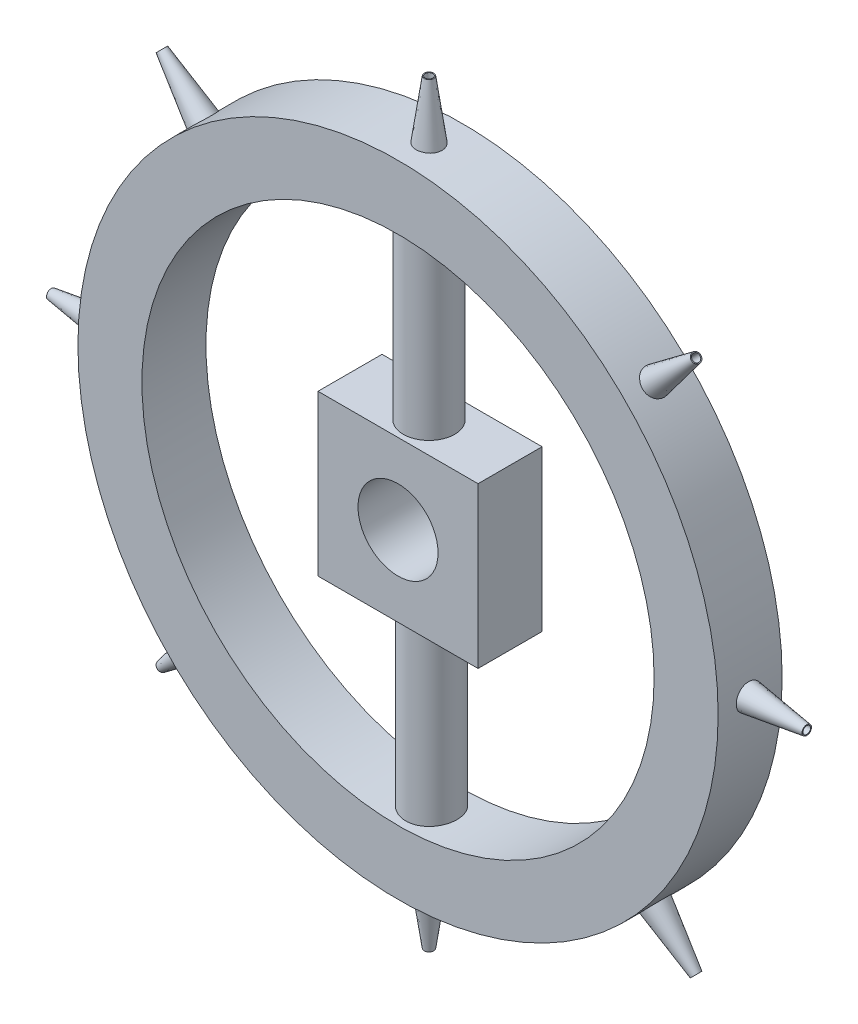
from build123d import *

# Parameters (mm, degrees)
SKETCH1_R                = 100
SKETCH1_R_2              = 80
BOSS_EXTRUDE1_DEPTH      = 20
SKETCH3_W                = 50
SKETCH3_H                = 50
BOSS_EXTRUDE2_DEPTH      = 20
BOSS_EXTRUDE3_REACH      = 163.323
BOSS_EXTRUDE3_END_RADIUS = 80
SKETCH4_R                = 8
BOSS_EXTRUDE4_REACH      = 163.323
BOSS_EXTRUDE4_END_RADIUS = 80
SKETCH5_R                = 8
SKETCH6_R                = 12.5
CUT_EXTRUDE1_DEPTH       = 20
SKETCH25_R               = 1.189610787
CUT_EXTRUDE4_DEPTH       = 35
CIRPATTERN4_COUNT        = 8


# Read off the part's stored shape, not the designer's step: Boss-Extrude7
with BuildPart() as part:
    # Sketch1 → Boss-Extrude1 (new body)
    with BuildSketch(Plane.XY):
        Circle(SKETCH1_R)
        Circle(SKETCH1_R_2, mode=Mode.SUBTRACT)
    extrude(amount=BOSS_EXTRUDE1_DEPTH)



with BuildPart() as body_2:
    # Sketch3 → Boss-Extrude2 (new body)
    with BuildSketch(Plane.XY):
        Rectangle(SKETCH3_W, SKETCH3_H)
    extrude(amount=BOSS_EXTRUDE2_DEPTH)


with BuildPart() as part_1:
    add(part.part)

    add(body_2.part)  # Boss-Extrude3 merges body 2
    # Boss-Extrude3: up to this cylinder (the profile starts inside it)
    boss_extrude3_end = Plane(origin=(0, 0, 10.323286), z_dir=(0, 0, -1)) * Cylinder(BOSS_EXTRUDE3_END_RADIUS, 487.646, mode=Mode.PRIVATE)
    # Sketch4 → Boss-Extrude3 (add, up to the surface)
    with BuildSketch(Plane(origin=(0, 25, 0), x_dir=(1, 0, 0), z_dir=(0, 1, 0)), mode=Mode.PRIVATE) as boss_extrude3_sk1:
        with Locations((0, -10.323286204)):
            Circle(SKETCH4_R)
    boss_extrude3_tool1 = extrude(boss_extrude3_sk1.sketch, amount=BOSS_EXTRUDE3_REACH, mode=Mode.PRIVATE) & boss_extrude3_end
    add(boss_extrude3_tool1.solids().sort_by_distance((0, 25, 10.323286))[0])

    # Boss-Extrude4: up to this cylinder (the profile starts inside it)
    boss_extrude4_end = Plane(origin=(0, 0, 9.540829), z_dir=(0, 0, -1)) * Cylinder(BOSS_EXTRUDE4_END_RADIUS, 487.646, mode=Mode.PRIVATE)
    # Sketch5 → Boss-Extrude4 (add, up to the surface)
    with BuildSketch(Plane.XZ.offset(25), mode=Mode.PRIVATE) as boss_extrude4_sk1:
        with Locations(Location((0, 9.540828597, 0), (0, 0, 180))):
            Circle(SKETCH5_R)
    boss_extrude4_tool1 = extrude(boss_extrude4_sk1.sketch, amount=BOSS_EXTRUDE4_REACH, mode=Mode.PRIVATE) & boss_extrude4_end
    add(boss_extrude4_tool1.solids().sort_by_distance((0, -25, 9.540829))[0])

    # Sketch6 → Cut-Extrude1 (cut)
    with BuildSketch(Plane.XY.offset(20)):
        Circle(SKETCH6_R)
    extrude(amount=-CUT_EXTRUDE1_DEPTH, mode=Mode.SUBTRACT)


with BuildPart() as body_2_2:
    # Boss-Extrude7 outline → Boss-Extrude7 (revolve)
    with BuildSketch(Plane.XY.offset(10.323286204)):
        Polygon((0, 81.9), (5, 81.9), (5, 93), (1.486479132, 118), (0, 118), align=None)
    revolve(axis=Axis((0, 0, 10.323286204), (0, 1, 0)))


with BuildPart() as cut_extrude4_tool:
    # Sketch25 → Cut-Extrude4 (new body)
    with BuildSketch(Plane(origin=(0, 118, 0), x_dir=(1, 0, 0), z_dir=(0, 1, 0))):
        with Locations(Location((0, -10.323286204, 0), (0, 0, 180))):
            Circle(SKETCH25_R)
    extrude(amount=-CUT_EXTRUDE4_DEPTH)


with BuildPart() as part_2:
    add(part_1.part)

    # Cut-Extrude4: cut by cut_extrude4_tool
    add(cut_extrude4_tool.part, mode=Mode.SUBTRACT)


with BuildPart() as body_2_2_1:
    add(body_2_2.part)

    # Cut-Extrude4: cut by cut_extrude4_tool
    add(cut_extrude4_tool.part, mode=Mode.SUBTRACT)


with BuildPart() as cirpattern4_1:
    # CirPattern4: pattern copy
    add(body_2_2_1.part.rotate(Axis((0, 0, 0), (0, 0, 1)), 1 * 360 / CIRPATTERN4_COUNT))


with BuildPart() as cirpattern4_2:
    # CirPattern4: pattern copy
    add(body_2_2_1.part.rotate(Axis((0, 0, 0), (0, 0, 1)), 2 * 360 / CIRPATTERN4_COUNT))


with BuildPart() as cirpattern4_3:
    # CirPattern4: pattern copy
    add(body_2_2_1.part.rotate(Axis((0, 0, 0), (0, 0, 1)), 3 * 360 / CIRPATTERN4_COUNT))


with BuildPart() as cirpattern4_4:
    # CirPattern4: pattern copy
    add(body_2_2_1.part.rotate(Axis((0, 0, 0), (0, 0, 1)), 4 * 360 / CIRPATTERN4_COUNT))


with BuildPart() as cirpattern4_5:
    # CirPattern4: pattern copy
    add(body_2_2_1.part.rotate(Axis((0, 0, 0), (0, 0, 1)), 5 * 360 / CIRPATTERN4_COUNT))


with BuildPart() as cirpattern4_6:
    # CirPattern4: pattern copy
    add(body_2_2_1.part.rotate(Axis((0, 0, 0), (0, 0, 1)), 6 * 360 / CIRPATTERN4_COUNT))


with BuildPart() as cirpattern4_7:
    # CirPattern4: pattern copy
    add(body_2_2_1.part.rotate(Axis((0, 0, 0), (0, 0, 1)), 7 * 360 / CIRPATTERN4_COUNT))


solid = Compound([part_2.part, body_2_2_1.part, cirpattern4_1.part, cirpattern4_2.part, cirpattern4_3.part, cirpattern4_4.part, cirpattern4_5.part, cirpattern4_6.part, cirpattern4_7.part])
